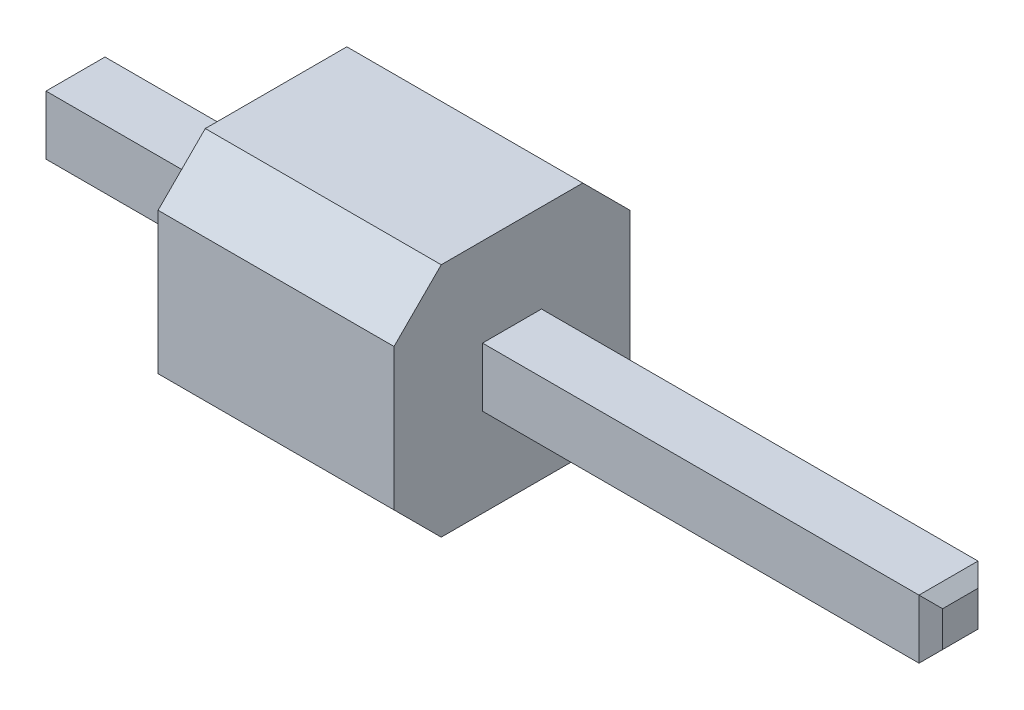
from build123d import *

# Parameters (mm, degrees)
PLASTIC_DEPTH = 2
SKETCH2_W     = 7.6
SKETCH2_H     = 0.5
CONTACT_DEPTH = 0.25
CHAMFER1_SIZE = 0.1


with BuildPart() as part:
    # Sketch1 → Plastic (new body)
    with BuildSketch(Plane(origin=(0, 0, 0), x_dir=(0, 0, -1), z_dir=(1, 0, 0))):
        Polygon((-1.6, 1), (-0.4, 1), (0, 0.6), (0, -0.6), (-0.4, -1), (-1.6, -1), (-2, -0.6), (-2, 0.6), align=None)
    extrude(amount=PLASTIC_DEPTH)

    # Sketch2 → Contact (add, symmetric)
    with BuildSketch(Plane(origin=(0, 0, 0), x_dir=(1, 0, 0), z_dir=(0, 1, 0))):
        with Locations((2, -1)):
            Rectangle(SKETCH2_W, SKETCH2_H)
    extrude(amount=CONTACT_DEPTH, both=True)

    # Chamfer1
    chamfer1_edges = [part.edges().sort_by_distance(p)[0] for p in [
        (5.8, 0.25, 1),
        (5.8, 0, 1.25),
        (5.8, -0.25, 1),
        (5.8, 0, 0.75),
        (-1.8, -0.25, 1),
        (-1.8, 0, 0.75),
        (-1.8, 0.25, 1),
        (-1.8, 0, 1.25),
    ]]
    chamfer(chamfer1_edges, length=CHAMFER1_SIZE)


solid = part.part
